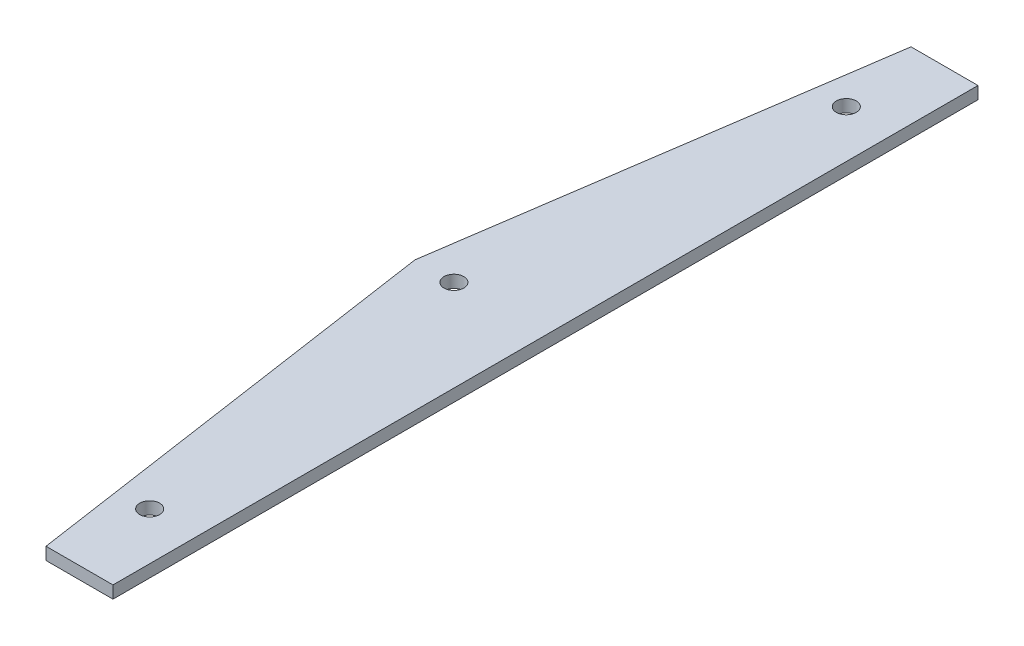
from build123d import *

# Parameters (mm, degrees)
SKETCH1_R      = 2.5527
MAINBODY_DEPTH = 3.175


with BuildPart() as part:
    # Sketch1 → MainBody (new body)
    with BuildSketch(Plane(origin=(0, 7.659460084, 0), x_dir=(1, 0, 0), z_dir=(0, 1, 0))):
        Polygon((-141.5163305, 104.251042847), (-124.323681089, 104.251042847), (-124.323681089, -117.799669373), (-141.5163305, -117.799669373), (-157.82954988, -6.774313263), align=None)
        with Locations((-136.5163305, -96.185148791)):
            Circle(SKETCH1_R, mode=Mode.SUBTRACT)
        with Locations((-147.82954988, -6.774313263)):
            Circle(SKETCH1_R, mode=Mode.SUBTRACT)
        with Locations((-136.5163305, 82.636522264)):
            Circle(SKETCH1_R, mode=Mode.SUBTRACT)
    extrude(amount=-MAINBODY_DEPTH)


solid = part.part
